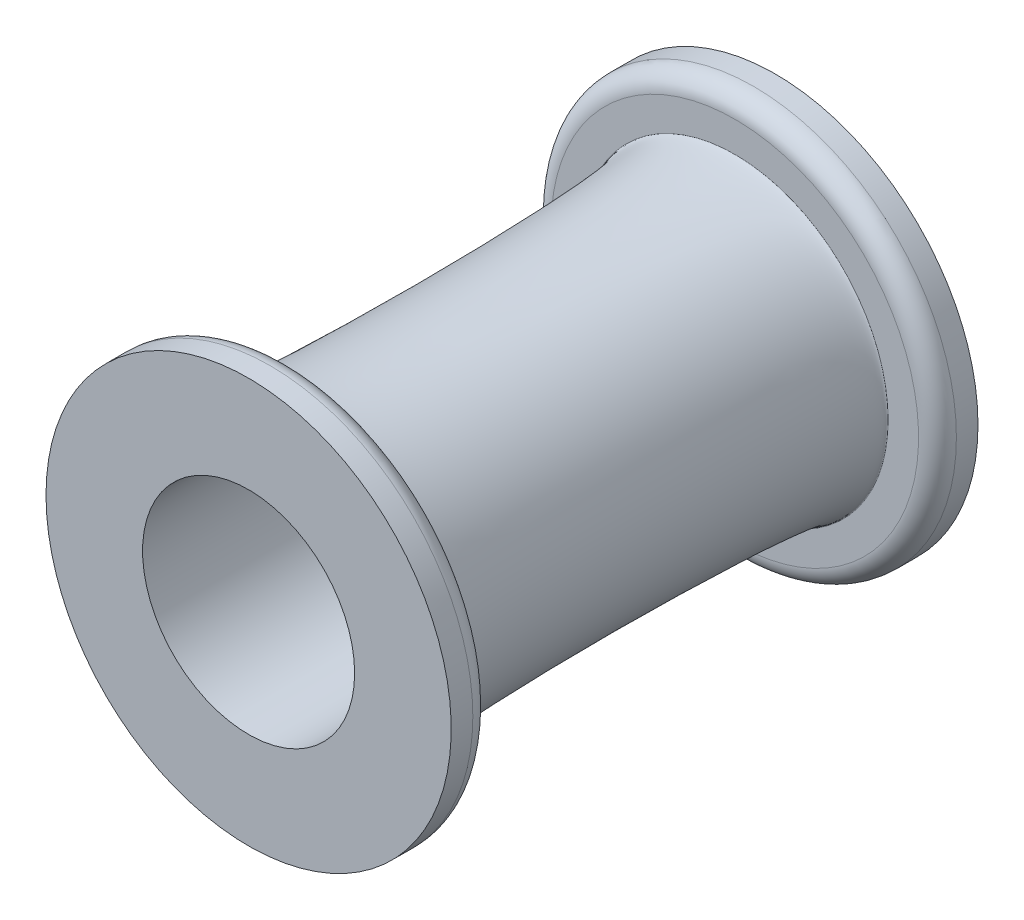
from build123d import *

# Parameters (mm, degrees)
SKETCH1_R           = 14.4145
SKETCH1_R_2         = 9.9695
BOSS_EXTRUDE1_DEPTH = 41.91
SKETCH2_R           = 19.05
SKETCH2_R_2         = 9.9695
BOSS_EXTRUDE2_DEPTH = 3.81
FILLET1_R           = 1.778
SKETCH3_RX          = 20.955
SKETCH3_RY          = 1.135862225


with BuildPart() as part:
    # Sketch1 → Boss-Extrude1 (new body)
    with BuildSketch(Plane.XY):
        Circle(SKETCH1_R)
        Circle(SKETCH1_R_2, mode=Mode.SUBTRACT)
    extrude(amount=BOSS_EXTRUDE1_DEPTH)

    # Sketch2 → Boss-Extrude2 (add)
    with BuildSketch(Plane.XY.offset(41.91)):
        Circle(SKETCH2_R)
        Circle(SKETCH2_R_2, mode=Mode.SUBTRACT)
    boss_extrude2 = extrude(amount=BOSS_EXTRUDE2_DEPTH)

    # Mirror1: Boss-Extrude2 across plane
    add(boss_extrude2.mirror(Plane.XY.offset(20.955)))

    # Fillet1
    fillet1_edges = [part.edges().sort_by_distance(p)[0] for p in [
        (-19.05, 0, 41.91),
        (-19.05, 0, 0),
    ]]
    fillet(fillet1_edges, radius=FILLET1_R)

    # Sketch3 → Cut-Revolve1 (revolve, cut)
    with BuildSketch(Plane(origin=(0, 0, 0), x_dir=(1, 0, 0), z_dir=(0, 1, 0))):
        with Locations(Location((-14.4145, -20.955), (0, 0, -90))):
            Ellipse(SKETCH3_RX, SKETCH3_RY)
    revolve(axis=Axis((0, 0, 45.72), (0, 0, -1)), mode=Mode.SUBTRACT)


solid = part.part
